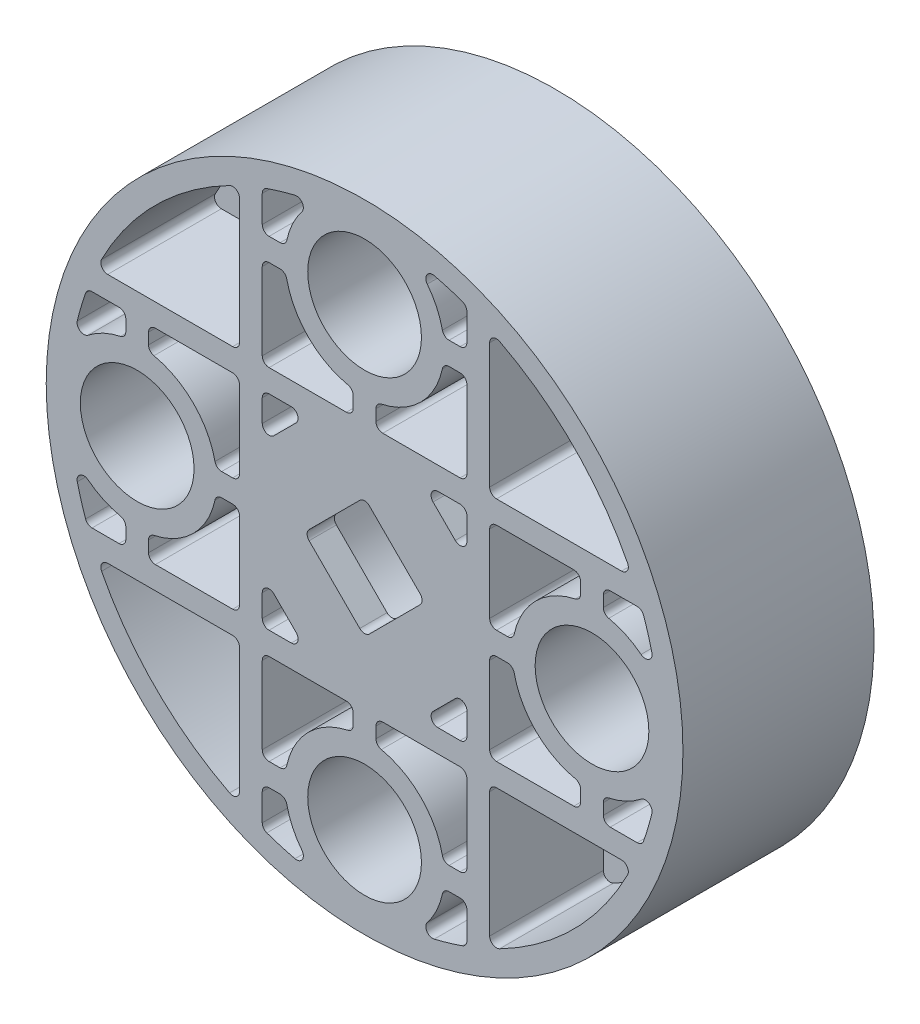
from build123d import *
from build123d.topology import SkipClean

# Parameters (mm, degrees)
SKETCH1_R            = 14
SKETCH1_R_2          = 2.5
BOSS_EXTRUDE1_DEPTH  = 9.2
CUT_EXTRUDE1_DEPTH   = 35.709580012
CUT_EXTRUDE2_DEPTH   = 5
CUT_EXTRUDE3_START   = -0.8
SKETCH4_R            = 13
CUT_EXTRUDE3_DEPTH   = 0.8
SKETCH5_R            = 4.25
CUT_EXTRUDE4_DEPTH   = 0.7
BOSS_EXTRUDE2_START  = 0.8
SKETCH6_R            = 5.25
SKETCH6_R_2          = 4.25
BOSS_EXTRUDE2_DEPTH  = 0.8
CUT_EXTRUDE5_START   = -2.4
CUT_EXTRUDE5_DEPTH   = 2.4
CHAMFER1_SIZE        = 0.6
CUT_EXTRUDE6_DEPTH   = 5
BOSS_EXTRUDE3_DEPTH  = 5
BOSS_EXTRUDE4_DEPTH  = 0.2
CUT_EXTRUDE7_DEPTH   = 0.2
BOSS_EXTRUDE6_DEPTH  = 5
SKETCH14_R           = 18.403092228
CUT_EXTRUDE8_DEPTH   = 14
SKETCH15_W           = 9
SKETCH15_H           = 9
CUT_EXTRUDE9_DEPTH   = 2.4
CUT_EXTRUDE10_DEPTH  = 35.506158068
BOSS_EXTRUDE7_START  = -5.8
BOSS_EXTRUDE7_DEPTH  = 5.8
BOSS_EXTRUDE8_DEPTH  = 2.4
FILLET2_R            = 0.3
CUT_EXTRUDE11_DEPTH  = 7.2
BOSS_EXTRUDE9_DEPTH  = 7.2
BOSS_EXTRUDE10_REACH = 36.506
CUT_EXTRUDE13_START  = -5
CUT_EXTRUDE13_DEPTH  = 5
CUT_EXTRUDE14_DEPTH  = 7.2
FILLET3_R            = 0.3


with BuildPart() as part:
    # Sketch1 → Boss-Extrude1 (new body)
    with BuildSketch(Plane.XY):
        with Locations((-8.02441701, -11.2)):
            Circle(SKETCH1_R)
        with Locations((-18.02441701, -11.2)):
            Circle(SKETCH1_R_2, mode=Mode.SUBTRACT)
        with Locations((-8.02441701, -1.2)):
            Circle(SKETCH1_R_2, mode=Mode.SUBTRACT)
        with Locations((-8.02441701, -21.2)):
            Circle(SKETCH1_R_2, mode=Mode.SUBTRACT)
        with Locations((1.97558299, -11.2)):
            Circle(SKETCH1_R_2, mode=Mode.SUBTRACT)
    extrude(amount=BOSS_EXTRUDE1_DEPTH)

    # Sketch2 → Cut-Extrude1 (cut, through all)
    with BuildSketch(Plane.XY.offset(9.2)):
        with BuildLine():
            Line((-9.97441701, -9.480261648), (-9.97441701, -12.919738352))
            ThreePointArc((-9.97441701, -12.919738352), (-8.02441701, -13.8), (-6.07441701, -12.919738352))
            Line((-6.07441701, -12.919738352), (-6.07441701, -9.480261648))
            ThreePointArc((-6.07441701, -9.480261648), (-8.02441701, -8.6), (-9.97441701, -9.480261648))
        make_face()
    extrude(amount=-CUT_EXTRUDE1_DEPTH, mode=Mode.SUBTRACT)

    # Sketch3 → Cut-Extrude2 (cut)
    with BuildSketch(Plane.XY.offset(9.2)):
        with BuildLine():
            Line((-19.803635999, -5.7), (-13.52441701, -5.7))
            Line((-13.52441701, -5.7), (-13.52441701, 0.579218989))
            ThreePointArc((-13.52441701, 0.579218989), (-17.216805165, -2.007611845), (-19.803635999, -5.7))
        make_face()
        with BuildLine():
            Line((-12.52441701, 0.996310918), (-12.52441701, -5.7))
            Line((-12.52441701, -5.7), (-3.52441701, -5.7))
            Line((-3.52441701, -5.7), (-3.52441701, 0.996310918))
            ThreePointArc((-3.52441701, 0.996310918), (-4.734236904, 1.376752954), (-5.975369975, 1.6375))
            ThreePointArc((-5.975369975, 1.6375), (-4.908196172, 0.393476605), (-4.52441701, -1.2))
            ThreePointArc((-4.52441701, -1.2), (-9.617893614, -4.316220838), (-10.073464044, 1.6375))
            ThreePointArc((-10.073464044, 1.6375), (-11.314597115, 1.376752954), (-12.52441701, 0.996310918))
        make_face()
        with BuildLine():
            Line((-20.220727927, -15.7), (-13.52441701, -15.7))
            Line((-13.52441701, -15.7), (-13.52441701, -6.7))
            Line((-13.52441701, -6.7), (-20.02441701, -6.7))
            Line((-20.02441701, -6.7), (-20.220727927, -6.7))
            ThreePointArc((-20.220727927, -6.7), (-20.601169964, -7.909819895), (-20.86191701, -9.150952965))
            ThreePointArc((-20.86191701, -9.150952965), (-16.947674236, -7.869741001), (-14.52441701, -11.2))
            ThreePointArc((-14.52441701, -11.2), (-16.947674236, -14.530258999), (-20.86191701, -13.249047035))
            ThreePointArc((-20.86191701, -13.249047035), (-20.601169964, -14.490180105), (-20.220727927, -15.7))
        make_face()
        with BuildLine():
            Line((-12.52441701, -6.7), (-12.52441701, -15.7))
            Line((-12.52441701, -15.7), (-8.978356211, -15.7))
            ThreePointArc((-8.978356211, -15.7), (-10.700197469, -14.94168397), (-11.97441701, -13.557435047))
            Line((-11.97441701, -13.557435047), (-11.97441701, -8.842564953))
            ThreePointArc((-11.97441701, -8.842564953), (-10.700197469, -7.45831603), (-8.978356211, -6.7))
            Line((-8.978356211, -6.7), (-12.52441701, -6.7))
        make_face()
        with BuildLine():
            Line((-7.070477808, -15.7), (-3.52441701, -15.7))
            Line((-3.52441701, -15.7), (-3.52441701, -6.7))
            Line((-3.52441701, -6.7), (-7.070477808, -6.7))
            ThreePointArc((-7.070477808, -6.7), (-5.34863655, -7.45831603), (-4.07441701, -8.842564953))
            Line((-4.07441701, -8.842564953), (-4.07441701, -13.557435047))
            ThreePointArc((-4.07441701, -13.557435047), (-5.34863655, -14.94168397), (-7.070477808, -15.7))
        make_face()
        with BuildLine():
            Line((-2.52441701, -6.7), (-2.52441701, -15.7))
            Line((-2.52441701, -15.7), (4.171893908, -15.7))
            ThreePointArc((4.171893908, -15.7), (4.552335945, -14.490180105), (4.81308299, -13.249047035))
            ThreePointArc((4.81308299, -13.249047035), (-1.52441701, -11.2), (4.81308299, -9.150952965))
            ThreePointArc((4.81308299, -9.150952965), (4.552335945, -7.909819895), (4.171893908, -6.7))
            Line((4.171893908, -6.7), (-2.52441701, -6.7))
        make_face()
        with BuildLine():
            Line((-2.52441701, 0.579218989), (-2.52441701, -5.7))
            Line((-2.52441701, -5.7), (3.75480198, -5.7))
            ThreePointArc((3.75480198, -5.7), (1.167971146, -2.007611845), (-2.52441701, 0.579218989))
        make_face()
        with BuildLine():
            Line((3.75480198, -16.7), (-2.52441701, -16.7))
            Line((-2.52441701, -16.7), (-2.52441701, -22.979218989))
            ThreePointArc((-2.52441701, -22.979218989), (1.167971146, -20.392388155), (3.75480198, -16.7))
        make_face()
        with BuildLine():
            Line((-12.52441701, -16.7), (-12.52441701, -23.2))
            Line((-12.52441701, -23.2), (-12.52441701, -23.396310918))
            ThreePointArc((-12.52441701, -23.396310918), (-11.314597115, -23.776752954), (-10.073464044, -24.0375))
            ThreePointArc((-10.073464044, -24.0375), (-9.617893614, -18.083779162), (-4.52441701, -21.2))
            ThreePointArc((-4.52441701, -21.2), (-4.908196172, -22.793476605), (-5.975369975, -24.0375))
            ThreePointArc((-5.975369975, -24.0375), (-4.734236904, -23.776752954), (-3.52441701, -23.396310918))
            Line((-3.52441701, -23.396310918), (-3.52441701, -16.7))
            Line((-3.52441701, -16.7), (-12.52441701, -16.7))
        make_face()
        with BuildLine():
            ThreePointArc((-19.803635999, -16.7), (-17.216805165, -20.392388155), (-13.52441701, -22.979218989))
            Line((-13.52441701, -22.979218989), (-13.52441701, -16.7))
            Line((-13.52441701, -16.7), (-19.803635999, -16.7))
        make_face()
    extrude(amount=-CUT_EXTRUDE2_DEPTH, mode=Mode.SUBTRACT)

    # Sketch4 → Cut-Extrude3 (cut)
    with BuildSketch(Plane(origin=(0, 0, 0), x_dir=(-1, 0, 0), z_dir=(0, 0, -1)).offset(CUT_EXTRUDE3_START)):
        with Locations((8.02441701, -11.2)):
            Circle(SKETCH4_R)
    extrude(amount=CUT_EXTRUDE3_DEPTH, mode=Mode.SUBTRACT)

    # Sketch5 → Cut-Extrude4 (cut)
    with BuildSketch(Plane(origin=(0, 0, 0.8), x_dir=(-1, 0, 0), z_dir=(0, 0, -1))):
        with Locations((8.02441701, -11.2)):
            Circle(SKETCH5_R)
    extrude(amount=-CUT_EXTRUDE4_DEPTH, mode=Mode.SUBTRACT)

    # Sketch6 → Boss-Extrude2 (add)
    with BuildSketch(Plane(origin=(0, 0, 0.8), x_dir=(-1, 0, 0), z_dir=(0, 0, -1)).offset(BOSS_EXTRUDE2_START)):
        with Locations(Location((8.02441701, -11.2, 0), (0, 0, 180))):
            Circle(SKETCH6_R)
        with Locations(Location((8.02441701, -11.2, 0), (0, 0, 180))):
            Circle(SKETCH6_R_2, mode=Mode.SUBTRACT)
    extrude(amount=-BOSS_EXTRUDE2_DEPTH)

    # Sketch7 → Cut-Extrude5 (cut)
    with SkipClean():  # the faces are left unmerged after this step: merging them gives an invalid solid
        with BuildSketch(Plane(origin=(0, 0, 0.8), x_dir=(-1, 0, 0), z_dir=(0, 0, -1)).offset(CUT_EXTRUDE5_START)):
            with BuildLine():
                Line((2.52441701, -5.7), (2.52441701, 0.579218989))
                ThreePointArc((2.52441701, 0.579218989), (-1.167971146, -2.007611845), (-3.75480198, -5.7))
                Line((-3.75480198, -5.7), (2.52441701, -5.7))
            make_face()
            with BuildLine():
                Line((2.52441701, -6.7), (-4.171893908, -6.7))
                ThreePointArc((-4.171893908, -6.7), (-4.552335945, -7.909819895), (-4.81308299, -9.150952965))
                ThreePointArc((-4.81308299, -9.150952965), (-0.898840217, -7.869741001), (1.52441701, -11.2))
                ThreePointArc((1.52441701, -11.2), (-0.898840217, -14.530258999), (-4.81308299, -13.249047035))
                ThreePointArc((-4.81308299, -13.249047035), (-4.552335945, -14.490180105), (-4.171893908, -15.7))
                Line((-4.171893908, -15.7), (2.52441701, -15.7))
                Line((2.52441701, -15.7), (2.52441701, -6.7))
            make_face()
            with BuildLine():
                Line((2.52441701, -16.7), (-3.75480198, -16.7))
                ThreePointArc((-3.75480198, -16.7), (-1.167971146, -20.392388155), (2.52441701, -22.979218989))
                Line((2.52441701, -22.979218989), (2.52441701, -16.7))
            make_face()
            with BuildLine():
                Line((3.52441701, -16.7), (3.52441701, -23.396310918))
                ThreePointArc((3.52441701, -23.396310918), (4.734236904, -23.776752954), (5.975369975, -24.0375))
                ThreePointArc((5.975369975, -24.0375), (6.430940405, -18.083779162), (11.52441701, -21.2))
                ThreePointArc((11.52441701, -21.2), (11.140637848, -22.793476605), (10.073464044, -24.0375))
                ThreePointArc((10.073464044, -24.0375), (11.314597115, -23.776752954), (12.52441701, -23.396310918))
                Line((12.52441701, -23.396310918), (12.52441701, -16.7))
                Line((12.52441701, -16.7), (3.52441701, -16.7))
            make_face()
            with BuildLine():
                Line((3.52441701, 0.996310918), (3.52441701, -5.7))
                Line((3.52441701, -5.7), (12.52441701, -5.7))
                Line((12.52441701, -5.7), (12.52441701, 0.996310918))
                ThreePointArc((12.52441701, 0.996310918), (11.314597115, 1.376752954), (10.073464044, 1.6375))
                ThreePointArc((10.073464044, 1.6375), (11.140637848, 0.393476605), (11.52441701, -1.2))
                ThreePointArc((11.52441701, -1.2), (6.430940405, -4.316220838), (5.975369975, 1.6375))
                ThreePointArc((5.975369975, 1.6375), (4.734236904, 1.376752954), (3.52441701, 0.996310918))
            make_face()
            with BuildLine():
                ThreePointArc((19.803635999, -5.7), (17.216805165, -2.007611845), (13.52441701, 0.579218989))
                Line((13.52441701, 0.579218989), (13.52441701, -5.7))
                Line((13.52441701, -5.7), (19.803635999, -5.7))
            make_face()
            with BuildLine():
                ThreePointArc((20.86191701, -9.150952965), (20.601169964, -7.909819895), (20.220727927, -6.7))
                Line((20.220727927, -6.7), (13.52441701, -6.7))
                Line((13.52441701, -6.7), (13.52441701, -15.7))
                Line((13.52441701, -15.7), (20.220727927, -15.7))
                ThreePointArc((20.220727927, -15.7), (20.601169964, -14.490180105), (20.86191701, -13.249047035))
                ThreePointArc((20.86191701, -13.249047035), (14.52441701, -11.2), (20.86191701, -9.150952965))
            make_face()
            with BuildLine():
                ThreePointArc((13.52441701, -22.979218989), (17.216805165, -20.392388155), (19.803635999, -16.7))
                Line((19.803635999, -16.7), (13.52441701, -16.7))
                Line((13.52441701, -16.7), (13.52441701, -22.979218989))
            make_face()
            with BuildLine():
                Line((10.728580466, -15.7), (12.52441701, -15.7))
                Line((12.52441701, -15.7), (12.52441701, -13.904163457))
                ThreePointArc((12.52441701, -13.904163457), (11.736727611, -14.912310601), (10.728580466, -15.7))
            make_face()
            with BuildLine():
                ThreePointArc((10.728580466, -6.7), (11.736727611, -7.487689399), (12.52441701, -8.495836543))
                Line((12.52441701, -8.495836543), (12.52441701, -6.7))
                Line((12.52441701, -6.7), (10.728580466, -6.7))
            make_face()
            with BuildLine():
                Line((3.52441701, -6.7), (3.52441701, -8.495836543))
                ThreePointArc((3.52441701, -8.495836543), (4.312106408, -7.487689399), (5.320253553, -6.7))
                Line((5.320253553, -6.7), (3.52441701, -6.7))
            make_face()
            with BuildLine():
                Line((3.52441701, -15.7), (5.320253553, -15.7))
                ThreePointArc((5.320253553, -15.7), (4.312106408, -14.912310601), (3.52441701, -13.904163457))
                Line((3.52441701, -13.904163457), (3.52441701, -15.7))
            make_face()
        extrude(amount=CUT_EXTRUDE5_DEPTH, mode=Mode.SUBTRACT)

    # Chamfer1
    chamfer1_edges = [part.edges().sort_by_distance(p)[0] for p in [
        (-8.02441701, -8.6, 1.5),
        (-6.07441701, -11.2, 1.5),
        (-8.02441701, -13.8, 1.5),
        (-9.97441701, -11.2, 1.5),
    ]]
    chamfer(chamfer1_edges, length=CHAMFER1_SIZE)

    # Sketch8 → Cut-Extrude6 (cut)
    with BuildSketch(Plane.XY.offset(9.2)):
        with BuildLine():
            ThreePointArc((-8.978356211, -6.7), (-10.700197469, -7.45831603), (-11.97441701, -8.842564953))
            Line((-11.97441701, -8.842564953), (-11.97441701, -11.084136008))
            Line((-11.97441701, -11.084136008), (-8.02441701, -7.134136008))
            Line((-8.02441701, -7.134136008), (-4.07441701, -11.084136008))
            Line((-4.07441701, -11.084136008), (-4.07441701, -8.842564953))
            ThreePointArc((-4.07441701, -8.842564953), (-5.34863655, -7.45831603), (-7.070477808, -6.7))
            Line((-7.070477808, -6.7), (-8.978356211, -6.7))
        make_face()
        with BuildLine():
            Line((-8.02441701, -15.265863992), (-11.97441701, -11.315863992))
            Line((-11.97441701, -11.315863992), (-11.97441701, -13.557435047))
            ThreePointArc((-11.97441701, -13.557435047), (-10.700197469, -14.94168397), (-8.978356211, -15.7))
            Line((-8.978356211, -15.7), (-7.070477808, -15.7))
            ThreePointArc((-7.070477808, -15.7), (-5.34863655, -14.94168397), (-4.07441701, -13.557435047))
            Line((-4.07441701, -13.557435047), (-4.07441701, -11.315863992))
            Line((-4.07441701, -11.315863992), (-8.02441701, -15.265863992))
        make_face()
    extrude(amount=-CUT_EXTRUDE6_DEPTH, mode=Mode.SUBTRACT)

    # Sketch9 → Boss-Extrude3 (add)
    with BuildSketch(Plane.XY.offset(9.2)):
        Polygon((-12.090281001, -11.2), (-11.97441701, -11.315863992), (-11.97441701, -11.084136008), align=None)
        Polygon((-4.07441701, -11.084136008), (-4.07441701, -11.315863992), (-3.958553018, -11.2), align=None)
    extrude(amount=-BOSS_EXTRUDE3_DEPTH)

    # Sketch10 → Boss-Extrude4 (add)
    with SkipClean():  # the faces are left unmerged after this step: merging them gives an invalid solid
        with BuildSketch(Plane.XY.offset(9.2)):
            Polygon((-8.02441701, -7.134136008), (-12.090281001, -11.2), (-8.02441701, -15.265863992), (-3.958553018, -11.2), align=None)
        extrude(amount=-BOSS_EXTRUDE4_DEPTH)

    # Sketch11 → Cut-Extrude7 (cut)
    with BuildSketch(Plane.XY.offset(9.2)):
        Polygon((-8.02441701, -8.548349571), (-10.676067439, -11.2), (-8.02441701, -13.851650429), (-5.37276658, -11.2), align=None)
    extrude(amount=-CUT_EXTRUDE7_DEPTH, mode=Mode.SUBTRACT)

    # Sketch13 → Boss-Extrude6 (add)
    with BuildSketch(Plane.XY.offset(9.2)):
        with BuildLine():
            ThreePointArc((-11.488518625, -21.7), (-11.52441701, -21.2), (-11.488518625, -20.7))
            Line((-11.488518625, -20.7), (-12.52441701, -20.7))
            Line((-12.52441701, -20.7), (-12.52441701, -21.7))
            Line((-12.52441701, -21.7), (-11.488518625, -21.7))
        make_face()
        with BuildLine():
            Line((-7.52441701, -16.7), (-8.52441701, -16.7))
            Line((-8.52441701, -16.7), (-8.52441701, -17.735898385))
            ThreePointArc((-8.52441701, -17.735898385), (-8.02441701, -17.7), (-7.52441701, -17.735898385))
            Line((-7.52441701, -17.735898385), (-7.52441701, -16.7))
        make_face()
        with BuildLine():
            Line((-3.52441701, -20.7), (-4.560315394, -20.7))
            ThreePointArc((-4.560315394, -20.7), (-4.52441701, -21.2), (-4.560315394, -21.7))
            Line((-4.560315394, -21.7), (-3.52441701, -21.7))
            Line((-3.52441701, -21.7), (-3.52441701, -20.7))
        make_face()
        with BuildLine():
            Line((1.47558299, -14.664101615), (1.47558299, -15.7))
            Line((1.47558299, -15.7), (2.47558299, -15.7))
            Line((2.47558299, -15.7), (2.47558299, -14.664101615))
            ThreePointArc((2.47558299, -14.664101615), (1.97558299, -14.7), (1.47558299, -14.664101615))
        make_face()
        with BuildLine():
            Line((-2.52441701, -10.7), (-2.52441701, -11.7))
            Line((-2.52441701, -11.7), (-1.488518625, -11.7))
            ThreePointArc((-1.488518625, -11.7), (-1.52441701, -11.2), (-1.488518625, -10.7))
            Line((-1.488518625, -10.7), (-2.52441701, -10.7))
        make_face()
        with BuildLine():
            Line((2.47558299, -6.7), (1.47558299, -6.7))
            Line((1.47558299, -6.7), (1.47558299, -7.735898385))
            ThreePointArc((1.47558299, -7.735898385), (1.97558299, -7.7), (2.47558299, -7.735898385))
            Line((2.47558299, -7.735898385), (2.47558299, -6.7))
        make_face()
        with BuildLine():
            Line((-4.560315394, -1.7), (-3.52441701, -1.7))
            Line((-3.52441701, -1.7), (-3.52441701, -0.7))
            Line((-3.52441701, -0.7), (-4.560315394, -0.7))
            ThreePointArc((-4.560315394, -0.7), (-4.52441701, -1.2), (-4.560315394, -1.7))
        make_face()
        with BuildLine():
            Line((-8.52441701, -4.664101615), (-8.52441701, -5.7))
            Line((-8.52441701, -5.7), (-7.52441701, -5.7))
            Line((-7.52441701, -5.7), (-7.52441701, -4.664101615))
            ThreePointArc((-7.52441701, -4.664101615), (-8.02441701, -4.7), (-8.52441701, -4.664101615))
        make_face()
        with BuildLine():
            Line((-12.52441701, -0.7), (-12.52441701, -1.7))
            Line((-12.52441701, -1.7), (-11.488518625, -1.7))
            ThreePointArc((-11.488518625, -1.7), (-11.52441701, -1.2), (-11.488518625, -0.7))
            Line((-11.488518625, -0.7), (-12.52441701, -0.7))
        make_face()
        with BuildLine():
            Line((-14.560315394, -11.7), (-13.52441701, -11.7))
            Line((-13.52441701, -11.7), (-13.52441701, -10.7))
            Line((-13.52441701, -10.7), (-14.560315394, -10.7))
            ThreePointArc((-14.560315394, -10.7), (-14.52441701, -11.2), (-14.560315394, -11.7))
        make_face()
        with BuildLine():
            Line((-18.52441701, -6.7), (-18.52441701, -7.735898385))
            ThreePointArc((-18.52441701, -7.735898385), (-18.02441701, -7.7), (-17.52441701, -7.735898385))
            Line((-17.52441701, -7.735898385), (-17.52441701, -6.7))
            Line((-17.52441701, -6.7), (-18.52441701, -6.7))
        make_face()
        with BuildLine():
            Line((-18.52441701, -14.664101615), (-18.52441701, -15.7))
            Line((-18.52441701, -15.7), (-17.52441701, -15.7))
            Line((-17.52441701, -15.7), (-17.52441701, -14.664101615))
            ThreePointArc((-17.52441701, -14.664101615), (-18.02441701, -14.7), (-18.52441701, -14.664101615))
        make_face()
        Polygon((-12.52441701, -10.7), (-12.52441701, -11.7), (-11.590281001, -11.7), (-12.090281001, -11.2), (-11.590281001, -10.7), align=None)
        Polygon((-3.958553018, -11.2), (-4.458553018, -11.7), (-3.52441701, -11.7), (-3.52441701, -10.7), (-4.458553018, -10.7), align=None)
        Polygon((-8.02441701, -15.265863992), (-8.52441701, -14.765863992), (-8.52441701, -15.7), (-7.52441701, -15.7), (-7.52441701, -14.765863992), align=None)
        Polygon((-8.52441701, -6.7), (-8.52441701, -7.634136008), (-8.02441701, -7.134136008), (-7.52441701, -7.634136008), (-7.52441701, -6.7), align=None)
    extrude(amount=-BOSS_EXTRUDE6_DEPTH)

    # Sketch14 → Cut-Extrude8 (cut)
    with BuildSketch(Plane(origin=(0, 0, 0.8), x_dir=(-1, 0, 0), z_dir=(0, 0, -1))):
        with Locations((8.02441701, -11.2)):
            Circle(SKETCH14_R)
    extrude(amount=CUT_EXTRUDE8_DEPTH, mode=Mode.SUBTRACT)

    # Sketch15 → Cut-Extrude9 (cut)
    with BuildSketch(Plane(origin=(0, 0, 0.8), x_dir=(-1, 0, 0), z_dir=(0, 0, -1))):
        with Locations((8.02441701, -11.2)):
            Rectangle(SKETCH15_W, SKETCH15_H)
    extrude(amount=-CUT_EXTRUDE9_DEPTH, mode=Mode.SUBTRACT)

    # Sketch18 → Cut-Extrude10 (cut, through all)
    with BuildSketch(Plane.XY.offset(9.2)):
        Polygon((-8.02441701, -8.548349571), (-10.676067439, -11.2), (-8.02441701, -13.851650429), (-5.37276658, -11.2), align=None)
    extrude(amount=-CUT_EXTRUDE10_DEPTH, mode=Mode.SUBTRACT)

    # Sketch19 → Boss-Extrude7 (add)
    with BuildSketch(Plane(origin=(0, 0, 3.2), x_dir=(-1, 0, 0), z_dir=(0, 0, -1)).offset(BOSS_EXTRUDE7_START)):
        with BuildLine():
            Line((6.07441701, -10.498349571), (7.972243042, -8.600523538))
            ThreePointArc((7.972243042, -8.600523538), (6.930954649, -8.841114656), (6.07441701, -9.480261648))
            Line((6.07441701, -9.480261648), (6.07441701, -10.498349571))
        make_face()
        with BuildLine():
            Line((9.97441701, -10.498349571), (8.076590977, -8.600523538))
            ThreePointArc((8.076590977, -8.600523538), (9.11787937, -8.841114656), (9.97441701, -9.480261648))
            Line((9.97441701, -9.480261648), (9.97441701, -10.498349571))
        make_face()
        with BuildLine():
            Line((7.972243042, -13.799476462), (6.07441701, -11.901650429))
            Line((6.07441701, -11.901650429), (6.07441701, -12.919738352))
            ThreePointArc((6.07441701, -12.919738352), (6.930954649, -13.558885344), (7.972243042, -13.799476462))
        make_face()
        with BuildLine():
            Line((8.076590977, -13.799476462), (9.97441701, -11.901650429))
            Line((9.97441701, -11.901650429), (9.97441701, -12.919738352))
            ThreePointArc((9.97441701, -12.919738352), (9.11787937, -13.558885344), (8.076590977, -13.799476462))
        make_face()
    extrude(amount=BOSS_EXTRUDE7_DEPTH)

    # Sketch20 → Boss-Extrude8 (add)
    with BuildSketch(Plane(origin=(0, 0, 3.2), x_dir=(-1, 0, 0), z_dir=(0, 0, -1))):
        with BuildLine():
            Line((-1.47558299, -7.735898385), (-1.47558299, -6.7))
            Line((-1.47558299, -6.7), (-2.47558299, -6.7))
            Line((-2.47558299, -6.7), (-2.47558299, -7.735898385))
            ThreePointArc((-2.47558299, -7.735898385), (-1.97558299, -7.7), (-1.47558299, -7.735898385))
        make_face()
        with BuildLine():
            Line((-1.47558299, -15.7), (-1.47558299, -14.664101615))
            ThreePointArc((-1.47558299, -14.664101615), (-1.97558299, -14.7), (-2.47558299, -14.664101615))
            Line((-2.47558299, -14.664101615), (-2.47558299, -15.7))
            Line((-2.47558299, -15.7), (-1.47558299, -15.7))
        make_face()
        with BuildLine():
            Line((2.52441701, -11.7), (2.52441701, -10.7))
            Line((2.52441701, -10.7), (1.488518625, -10.7))
            ThreePointArc((1.488518625, -10.7), (1.52441701, -11.2), (1.488518625, -11.7))
            Line((1.488518625, -11.7), (2.52441701, -11.7))
        make_face()
        Polygon((3.958553018, -11.2), (4.458553018, -10.7), (3.52441701, -10.7), (3.52441701, -11.7), (4.458553018, -11.7), align=None)
        Polygon((5.87276658, -10.7), (4.458553018, -10.7), (3.958553018, -11.2), (4.458553018, -11.7), (5.87276658, -11.7), (5.37276658, -11.2), align=None)
        Polygon((4.458553018, -11.7), (7.52441701, -14.765863992), (7.52441701, -13.351650429), (5.87276658, -11.7), align=None)
        Polygon((8.02441701, -15.265863992), (8.52441701, -14.765863992), (8.52441701, -13.351650429), (8.02441701, -13.851650429), (7.52441701, -13.351650429), (7.52441701, -14.765863992), align=None)
        Polygon((8.52441701, -14.765863992), (11.590281001, -11.7), (10.176067439, -11.7), (8.52441701, -13.351650429), align=None)
        Polygon((11.590281001, -11.7), (12.090281001, -11.2), (11.590281001, -10.7), (10.176067439, -10.7), (10.676067439, -11.2), (10.176067439, -11.7), align=None)
        Polygon((10.176067439, -10.7), (11.590281001, -10.7), (8.52441701, -7.634136008), (8.52441701, -9.048349571), align=None)
        Polygon((8.52441701, -9.048349571), (8.52441701, -7.634136008), (8.02441701, -7.134136008), (7.52441701, -7.634136008), (7.52441701, -9.048349571), (8.02441701, -8.548349571), align=None)
        Polygon((7.52441701, -9.048349571), (7.52441701, -7.634136008), (4.458553018, -10.7), (5.87276658, -10.7), align=None)
        Polygon((11.590281001, -10.7), (12.090281001, -11.2), (11.590281001, -11.7), (12.52441701, -11.7), (12.52441701, -10.7), align=None)
        Polygon((8.52441701, -15.7), (8.52441701, -14.765863992), (8.02441701, -15.265863992), (7.52441701, -14.765863992), (7.52441701, -15.7), align=None)
        Polygon((8.02441701, -7.134136008), (8.52441701, -7.634136008), (8.52441701, -6.7), (7.52441701, -6.7), (7.52441701, -7.634136008), align=None)
        with BuildLine():
            Line((7.52441701, -5.7), (8.52441701, -5.7))
            Line((8.52441701, -5.7), (8.52441701, -4.664101615))
            ThreePointArc((8.52441701, -4.664101615), (8.02441701, -4.7), (7.52441701, -4.664101615))
            Line((7.52441701, -4.664101615), (7.52441701, -5.7))
        make_face()
        with BuildLine():
            ThreePointArc((11.488518625, -0.7), (11.52441701, -1.2), (11.488518625, -1.7))
            Line((11.488518625, -1.7), (12.52441701, -1.7))
            Line((12.52441701, -1.7), (12.52441701, -0.7))
            Line((12.52441701, -0.7), (11.488518625, -0.7))
        make_face()
        with BuildLine():
            Line((3.52441701, -1.7), (4.560315394, -1.7))
            ThreePointArc((4.560315394, -1.7), (4.52441701, -1.2), (4.560315394, -0.7))
            Line((4.560315394, -0.7), (3.52441701, -0.7))
            Line((3.52441701, -0.7), (3.52441701, -1.7))
        make_face()
        with BuildLine():
            Line((14.560315394, -10.7), (13.52441701, -10.7))
            Line((13.52441701, -10.7), (13.52441701, -11.7))
            Line((13.52441701, -11.7), (14.560315394, -11.7))
            ThreePointArc((14.560315394, -11.7), (14.52441701, -11.2), (14.560315394, -10.7))
        make_face()
        with BuildLine():
            Line((18.52441701, -6.7), (17.52441701, -6.7))
            Line((17.52441701, -6.7), (17.52441701, -7.735898385))
            ThreePointArc((17.52441701, -7.735898385), (18.02441701, -7.7), (18.52441701, -7.735898385))
            Line((18.52441701, -7.735898385), (18.52441701, -6.7))
        make_face()
        with BuildLine():
            Line((17.52441701, -14.664101615), (17.52441701, -15.7))
            Line((17.52441701, -15.7), (18.52441701, -15.7))
            Line((18.52441701, -15.7), (18.52441701, -14.664101615))
            ThreePointArc((18.52441701, -14.664101615), (18.02441701, -14.7), (17.52441701, -14.664101615))
        make_face()
        with BuildLine():
            Line((8.52441701, -17.735898385), (8.52441701, -16.7))
            Line((8.52441701, -16.7), (7.52441701, -16.7))
            Line((7.52441701, -16.7), (7.52441701, -17.735898385))
            ThreePointArc((7.52441701, -17.735898385), (8.02441701, -17.7), (8.52441701, -17.735898385))
        make_face()
        with BuildLine():
            Line((12.52441701, -20.7), (11.488518625, -20.7))
            ThreePointArc((11.488518625, -20.7), (11.52441701, -21.2), (11.488518625, -21.7))
            Line((11.488518625, -21.7), (12.52441701, -21.7))
            Line((12.52441701, -21.7), (12.52441701, -20.7))
        make_face()
        with BuildLine():
            ThreePointArc((4.560315394, -21.7), (4.52441701, -21.2), (4.560315394, -20.7))
            Line((4.560315394, -20.7), (3.52441701, -20.7))
            Line((3.52441701, -20.7), (3.52441701, -21.7))
            Line((3.52441701, -21.7), (4.560315394, -21.7))
        make_face()
    extrude(amount=BOSS_EXTRUDE8_DEPTH)

    # Fillet2
    fillet2_edges = [part.edges().sort_by_distance(p)[0] for p in [
        (-10.676067439, -11.2, 5),
        (-8.02441701, -8.548349571, 5),
        (-5.37276658, -11.2, 5),
        (-8.02441701, -13.851650429, 5),
    ]]
    fillet(fillet2_edges, radius=FILLET2_R)

    # Sketch21 → Cut-Extrude11 (cut)
    with BuildSketch(Plane(origin=(0, 0, 0.8), x_dir=(-1, 0, 0), z_dir=(0, 0, -1))):
        with BuildLine():
            Line((12.016566047, -10.94950835), (8.27490866, -7.207850963))
            ThreePointArc((8.27490866, -7.207850963), (5.195989885, -8.371572875), (4.032267973, -11.45049165))
            Line((4.032267973, -11.45049165), (7.773925359, -15.192149037))
            ThreePointArc((7.773925359, -15.192149037), (10.852844134, -14.028427125), (12.016566047, -10.94950835))
        make_face()
    extrude(amount=-CUT_EXTRUDE11_DEPTH, mode=Mode.SUBTRACT)

    # Sketch22 → Boss-Extrude9 (add)
    with BuildSketch(Plane(origin=(0, 0, 0.8), x_dir=(-1, 0, 0), z_dir=(0, 0, -1))):
        with BuildLine():
            Line((3.074669541, -11.907106781), (7.317310228, -16.149747468))
            ThreePointArc((7.317310228, -16.149747468), (11.559950916, -14.735533906), (12.974164478, -10.492893219))
            Line((12.974164478, -10.492893219), (8.731523791, -6.250252532))
            ThreePointArc((8.731523791, -6.250252532), (4.488883104, -7.664466094), (3.074669541, -11.907106781))
        make_face()
        with BuildLine():
            Line((12.016566047, -10.94950835), (8.27490866, -7.207850963))
            ThreePointArc((8.27490866, -7.207850963), (5.195989885, -8.371572875), (4.032267973, -11.45049165))
            Line((4.032267973, -11.45049165), (7.773925359, -15.192149037))
            ThreePointArc((7.773925359, -15.192149037), (10.852844134, -14.028427125), (12.016566047, -10.94950835))
        make_face(mode=Mode.SUBTRACT)
    extrude(amount=-BOSS_EXTRUDE9_DEPTH)

    # Boss-Extrude10: up to this face of the body (flat: up to its plane)
    boss_extrude10_end = Plane(part.part.faces().sort_by_distance((-11.410035093, -7.814381917, 4.2))[0])
    # Sketch23 → Boss-Extrude10 (add, up to the picked face)
    with BuildSketch(Plane.XY.offset(9.2), mode=Mode.PRIVATE) as boss_extrude10_sk1:
        Polygon((-12.52441701, -10.043145751), (-12.52441701, -10.7), (-11.590281001, -10.7), (-8.52441701, -7.634136008), (-8.52441701, -6.7), (-9.181271259, -6.7), (-10.52441701, -6.7), (-12.52441701, -8.7), align=None)
    boss_extrude10_tool1 = split(extrude(boss_extrude10_sk1.sketch, amount=-BOSS_EXTRUDE10_REACH, mode=Mode.PRIVATE), bisect_by=boss_extrude10_end, keep=Keep.BOTH, mode=Mode.PRIVATE)
    # Sketch23 → Boss-Extrude10 (add, up to the picked face)
    with BuildSketch(Plane.XY.offset(9.2), mode=Mode.PRIVATE) as boss_extrude10_sk2:
        Polygon((-10.52441701, -15.7), (-10.203866481, -15.7), (-8.52441701, -15.7), (-8.52441701, -14.765863992), (-11.590281001, -11.7), (-12.52441701, -11.7), (-12.52441701, -13.379449472), (-12.52441701, -13.7), align=None)
    boss_extrude10_tool2 = split(extrude(boss_extrude10_sk2.sketch, amount=-BOSS_EXTRUDE10_REACH, mode=Mode.PRIVATE), bisect_by=boss_extrude10_end, keep=Keep.BOTH, mode=Mode.PRIVATE)
    # Sketch23 → Boss-Extrude10 (add, up to the picked face)
    with BuildSketch(Plane.XY.offset(9.2), mode=Mode.PRIVATE) as boss_extrude10_sk3:
        Polygon((-7.52441701, -14.765863992), (-7.52441701, -15.7), (-6.86756276, -15.7), (-5.52441701, -15.7), (-3.52441701, -13.7), (-3.52441701, -12.356854249), (-3.52441701, -11.7), (-4.458553018, -11.7), align=None)
    boss_extrude10_tool3 = split(extrude(boss_extrude10_sk3.sketch, amount=-BOSS_EXTRUDE10_REACH, mode=Mode.PRIVATE), bisect_by=boss_extrude10_end, keep=Keep.BOTH, mode=Mode.PRIVATE)
    # Sketch23 → Boss-Extrude10 (add, up to the picked face)
    with BuildSketch(Plane.XY.offset(9.2), mode=Mode.PRIVATE) as boss_extrude10_sk4:
        Polygon((-7.52441701, -7.634136008), (-4.458553018, -10.7), (-3.52441701, -10.7), (-3.52441701, -9.020550528), (-3.52441701, -8.7), (-5.52441701, -6.7), (-5.844967538, -6.7), (-7.52441701, -6.7), align=None)
    boss_extrude10_tool4 = split(extrude(boss_extrude10_sk4.sketch, amount=-BOSS_EXTRUDE10_REACH, mode=Mode.PRIVATE), bisect_by=boss_extrude10_end, keep=Keep.BOTH, mode=Mode.PRIVATE)
    add(boss_extrude10_tool1.solids().sort_by(Axis((-10.731929, -8.492488, 9.2), (0, 0, -1)))[0])
    add(boss_extrude10_tool2.solids().sort_by(Axis((-10.731929, -13.907512, 9.2), (0, 0, -1)))[0])
    add(boss_extrude10_tool3.solids().sort_by(Axis((-5.316905, -13.907512, 9.2), (0, 0, -1)))[0])
    add(boss_extrude10_tool4.solids().sort_by(Axis((-5.316905, -8.492488, 9.2), (0, 0, -1)))[0])

    # Sketch24 → Cut-Extrude13 (cut)
    with BuildSketch(Plane.XY.offset(9.2).offset(CUT_EXTRUDE13_START)):
        with BuildLine():
            Line((-4.02441701, -8.2), (-5.02441701, -7.2))
            ThreePointArc((-5.02441701, -7.2), (-4.488883104, -7.664466094), (-4.02441701, -8.2))
        make_face()
        with BuildLine():
            Line((-12.02441701, -14.2), (-11.02441701, -15.2))
            ThreePointArc((-11.02441701, -15.2), (-11.559950916, -14.735533906), (-12.02441701, -14.2))
        make_face()
    extrude(amount=CUT_EXTRUDE13_DEPTH, mode=Mode.SUBTRACT)

    # Sketch25 → Cut-Extrude14 (cut)
    with BuildSketch(Plane(origin=(0, 0, 0.8), x_dir=(-1, 0, 0), z_dir=(0, 0, -1))):
        with BuildLine():
            Line((12.016566047, -10.94950835), (8.27490866, -7.207850963))
            ThreePointArc((8.27490866, -7.207850963), (5.195989885, -8.371572875), (4.032267973, -11.45049165))
            Line((4.032267973, -11.45049165), (7.773925359, -15.192149037))
            ThreePointArc((7.773925359, -15.192149037), (10.852844134, -14.028427125), (12.016566047, -10.94950835))
        make_face()
    extrude(amount=-CUT_EXTRUDE14_DEPTH, mode=Mode.SUBTRACT)

    # Fillet3
    fillet3_edges = [part.edges().sort_by_distance(p)[0] for p in [
        (-12.52441701, -15.7, 6.7),
        (-12.52441701, -6.7, 6.7),
        (-3.52441701, -6.7, 6.7),
        (-3.52441701, -15.7, 6.7),
        (-19.803635999, -16.7, 6.7),
        (-13.52441701, -16.7, 6.7),
        (-13.52441701, -22.979218989, 6.7),
        (-13.52441701, 0.579218989, 6.7),
        (-13.52441701, -5.7, 6.7),
        (-19.803635999, -5.7, 6.7),
        (-11.488518625, -20.7, 6.7),
        (-12.52441701, -20.7, 6.7),
        (-12.52441701, -21.7, 6.7),
        (-11.488518625, -21.7, 6.7),
        (-8.52441701, -16.7, 6.7),
        (-8.52441701, -17.735898385, 6.7),
        (-7.52441701, -17.735898385, 6.7),
        (-7.52441701, -16.7, 6.7),
        (-3.52441701, -20.7, 6.7),
        (-4.560315394, -20.7, 6.7),
        (-4.560315394, -21.7, 6.7),
        (-3.52441701, -21.7, 6.7),
        (1.47558299, -14.664101615, 6.7),
        (1.47558299, -15.7, 6.7),
        (2.47558299, -15.7, 6.7),
        (2.47558299, -14.664101615, 6.7),
        (-2.52441701, -11.7, 6.7),
        (-1.488518625, -11.7, 6.7),
        (-1.488518625, -10.7, 6.7),
        (-2.52441701, -10.7, 6.7),
        (1.47558299, -6.7, 6.7),
        (1.47558299, -7.735898385, 6.7),
        (2.47558299, -7.735898385, 6.7),
        (2.47558299, -6.7, 6.7),
        (-3.52441701, -0.7, 6.7),
        (-3.52441701, -1.7, 6.7),
        (-4.560315394, -1.7, 6.7),
        (-4.560315394, -0.7, 6.7),
        (-8.52441701, -4.664101615, 6.7),
        (-8.52441701, -5.7, 6.7),
        (-7.52441701, -5.7, 6.7),
        (-7.52441701, -4.664101615, 6.7),
        (-11.488518625, -0.7, 6.7),
        (-11.488518625, -1.7, 6.7),
        (-12.52441701, -1.7, 6.7),
        (-12.52441701, -0.7, 6.7),
        (-14.560315394, -11.7, 6.7),
        (-13.52441701, -11.7, 6.7),
        (-13.52441701, -10.7, 6.7),
        (-14.560315394, -10.7, 6.7),
        (-18.52441701, -6.7, 6.7),
        (-18.52441701, -7.735898385, 6.7),
        (-17.52441701, -7.735898385, 6.7),
        (-17.52441701, -6.7, 6.7),
        (-18.52441701, -14.664101615, 6.7),
        (-18.52441701, -15.7, 6.7),
        (-17.52441701, -15.7, 6.7),
        (-17.52441701, -14.664101615, 6.7),
        (-12.52441701, -23.396310918, 6.7),
        (-12.52441701, -16.7, 6.7),
        (-3.52441701, -16.7, 6.7),
        (-3.52441701, -23.396310918, 6.7),
        (-5.975369975, -24.0375, 6.7),
        (-10.073464044, -24.0375, 6.7),
        (-2.52441701, -22.979218989, 6.7),
        (-10.52441701, -6.7, 6.7),
        (-12.52441701, -8.7, 6.7),
        (-2.52441701, -16.7, 6.7),
        (-12.52441701, -13.7, 6.7),
        (-10.52441701, -15.7, 6.7),
        (3.75480198, -16.7, 6.7),
        (-5.52441701, -15.7, 6.7),
        (-3.52441701, -13.7, 6.7),
        (-3.52441701, -8.7, 6.7),
        (-5.52441701, -6.7, 6.7),
        (3.75480198, -5.7, 6.7),
        (-2.52441701, -5.7, 6.7),
        (-2.52441701, 0.579218989, 6.7),
        (4.81308299, -9.150952965, 6.7),
        (4.81308299, -13.249047035, 6.7),
        (4.171893908, -15.7, 6.7),
        (-2.52441701, -15.7, 6.7),
        (-2.52441701, -6.7, 6.7),
        (4.171893908, -6.7, 6.7),
        (-3.52441701, 0.996310918, 6.7),
        (-3.52441701, -5.7, 6.7),
        (-12.52441701, -5.7, 6.7),
        (-12.52441701, 0.996310918, 6.7),
        (-10.073464044, 1.6375, 6.7),
        (-5.975369975, 1.6375, 6.7),
        (-20.220727927, -6.7, 6.7),
        (-13.52441701, -6.7, 6.7),
        (-13.52441701, -15.7, 6.7),
        (-20.220727927, -15.7, 6.7),
        (-20.86191701, -13.249047035, 6.7),
        (-20.86191701, -9.150952965, 6.7),
    ]]
    fillet(fillet3_edges, radius=FILLET3_R)


solid = part.part
